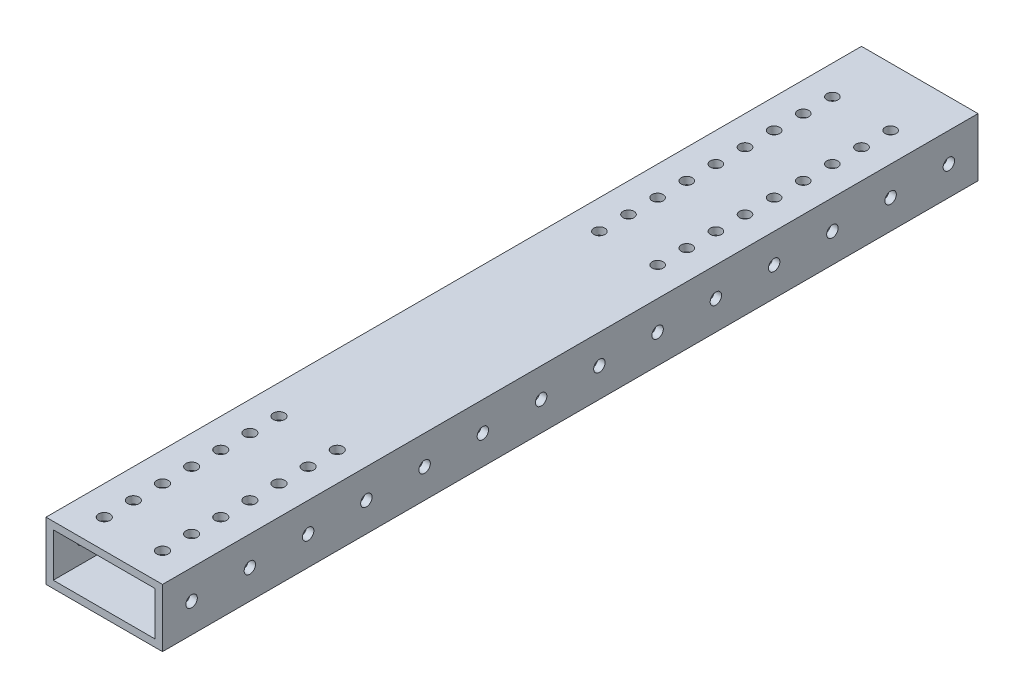
from build123d import *

# Parameters (mm, degrees)
SKETCH1_W           = 50.8
SKETCH1_H           = 25.4
SKETCH1_W_2         = 44.45
SKETCH1_H_2         = 19.05
BOSS_EXTRUDE1_DEPTH = 177.8
CUT_EXTRUDE1_REACH  = 183.392
SKETCH2_R           = 2.4892
SKETCH3_R           = 2.4892
CUT_EXTRUDE2_DEPTH  = 186.350397895
SKETCH4_R           = 2.413
CUT_EXTRUDE3_DEPTH  = 182.392282085


with BuildPart() as part:
    # Sketch1 → Boss-Extrude1 (new, symmetric)
    with BuildSketch(Plane.XY):
        Rectangle(SKETCH1_W, SKETCH1_H)
        Rectangle(SKETCH1_W_2, SKETCH1_H_2, mode=Mode.SUBTRACT)
    extrude(amount=BOSS_EXTRUDE1_DEPTH, both=True)

    # Sketch2 → Cut-Extrude1 (cut, up to next)
    with BuildSketch(Plane.XZ.offset(-12.7), mode=Mode.PRIVATE) as cut_extrude1_sk1:
        with Locations((-12.7, 165.1)):
            Circle(SKETCH2_R)
    cut_extrude1_tool1 = extrude(cut_extrude1_sk1.sketch, amount=CUT_EXTRUDE1_REACH, mode=Mode.PRIVATE) & part.part
    # Sketch2 → Cut-Extrude1 (cut, up to next)
    with BuildSketch(Plane.XZ.offset(-12.7), mode=Mode.PRIVATE) as cut_extrude1_sk2:
        with Locations((-12.7, 152.4)):
            Circle(SKETCH2_R)
    cut_extrude1_tool2 = extrude(cut_extrude1_sk2.sketch, amount=CUT_EXTRUDE1_REACH, mode=Mode.PRIVATE) & part.part
    # Sketch2 → Cut-Extrude1 (cut, up to next)
    with BuildSketch(Plane.XZ.offset(-12.7), mode=Mode.PRIVATE) as cut_extrude1_sk3:
        with Locations((-12.7, 139.7)):
            Circle(SKETCH2_R)
    cut_extrude1_tool3 = extrude(cut_extrude1_sk3.sketch, amount=CUT_EXTRUDE1_REACH, mode=Mode.PRIVATE) & part.part
    # Sketch2 → Cut-Extrude1 (cut, up to next)
    with BuildSketch(Plane.XZ.offset(-12.7), mode=Mode.PRIVATE) as cut_extrude1_sk4:
        with Locations((-12.7, 127)):
            Circle(SKETCH2_R)
    cut_extrude1_tool4 = extrude(cut_extrude1_sk4.sketch, amount=CUT_EXTRUDE1_REACH, mode=Mode.PRIVATE) & part.part
    # Sketch2 → Cut-Extrude1 (cut, up to next)
    with BuildSketch(Plane.XZ.offset(-12.7), mode=Mode.PRIVATE) as cut_extrude1_sk5:
        with Locations((-12.7, 114.3)):
            Circle(SKETCH2_R)
    cut_extrude1_tool5 = extrude(cut_extrude1_sk5.sketch, amount=CUT_EXTRUDE1_REACH, mode=Mode.PRIVATE) & part.part
    # Sketch2 → Cut-Extrude1 (cut, up to next)
    with BuildSketch(Plane.XZ.offset(-12.7), mode=Mode.PRIVATE) as cut_extrude1_sk6:
        with Locations((-12.7, 101.6)):
            Circle(SKETCH2_R)
    cut_extrude1_tool6 = extrude(cut_extrude1_sk6.sketch, amount=CUT_EXTRUDE1_REACH, mode=Mode.PRIVATE) & part.part
    # Sketch2 → Cut-Extrude1 (cut, up to next)
    with BuildSketch(Plane.XZ.offset(-12.7), mode=Mode.PRIVATE) as cut_extrude1_sk7:
        with Locations((-12.7, 88.9)):
            Circle(SKETCH2_R)
    cut_extrude1_tool7 = extrude(cut_extrude1_sk7.sketch, amount=CUT_EXTRUDE1_REACH, mode=Mode.PRIVATE) & part.part
    # Sketch2 → Cut-Extrude1 (cut, up to next)
    with BuildSketch(Plane.XZ.offset(-12.7), mode=Mode.PRIVATE) as cut_extrude1_sk8:
        with Locations((12.7, 165.1)):
            Circle(SKETCH2_R)
    cut_extrude1_tool8 = extrude(cut_extrude1_sk8.sketch, amount=CUT_EXTRUDE1_REACH, mode=Mode.PRIVATE) & part.part
    # Sketch2 → Cut-Extrude1 (cut, up to next)
    with BuildSketch(Plane.XZ.offset(-12.7), mode=Mode.PRIVATE) as cut_extrude1_sk9:
        with Locations((12.7, 152.4)):
            Circle(SKETCH2_R)
    cut_extrude1_tool9 = extrude(cut_extrude1_sk9.sketch, amount=CUT_EXTRUDE1_REACH, mode=Mode.PRIVATE) & part.part
    # Sketch2 → Cut-Extrude1 (cut, up to next)
    with BuildSketch(Plane.XZ.offset(-12.7), mode=Mode.PRIVATE) as cut_extrude1_sk10:
        with Locations((12.7, 139.7)):
            Circle(SKETCH2_R)
    cut_extrude1_tool10 = extrude(cut_extrude1_sk10.sketch, amount=CUT_EXTRUDE1_REACH, mode=Mode.PRIVATE) & part.part
    # Sketch2 → Cut-Extrude1 (cut, up to next)
    with BuildSketch(Plane.XZ.offset(-12.7), mode=Mode.PRIVATE) as cut_extrude1_sk11:
        with Locations((12.7, 127)):
            Circle(SKETCH2_R)
    cut_extrude1_tool11 = extrude(cut_extrude1_sk11.sketch, amount=CUT_EXTRUDE1_REACH, mode=Mode.PRIVATE) & part.part
    # Sketch2 → Cut-Extrude1 (cut, up to next)
    with BuildSketch(Plane.XZ.offset(-12.7), mode=Mode.PRIVATE) as cut_extrude1_sk12:
        with Locations((12.7, 114.3)):
            Circle(SKETCH2_R)
    cut_extrude1_tool12 = extrude(cut_extrude1_sk12.sketch, amount=CUT_EXTRUDE1_REACH, mode=Mode.PRIVATE) & part.part
    # Sketch2 → Cut-Extrude1 (cut, up to next)
    with BuildSketch(Plane.XZ.offset(-12.7), mode=Mode.PRIVATE) as cut_extrude1_sk13:
        with Locations((12.7, 101.6)):
            Circle(SKETCH2_R)
    cut_extrude1_tool13 = extrude(cut_extrude1_sk13.sketch, amount=CUT_EXTRUDE1_REACH, mode=Mode.PRIVATE) & part.part
    # Sketch2 → Cut-Extrude1 (cut, up to next)
    with BuildSketch(Plane.XZ.offset(-12.7), mode=Mode.PRIVATE) as cut_extrude1_sk14:
        with Locations((12.7, 88.9)):
            Circle(SKETCH2_R)
    cut_extrude1_tool14 = extrude(cut_extrude1_sk14.sketch, amount=CUT_EXTRUDE1_REACH, mode=Mode.PRIVATE) & part.part
    add(cut_extrude1_tool1.solids().sort_by_distance((-12.7, 12.7, 165.1))[0], mode=Mode.SUBTRACT)
    add(cut_extrude1_tool2.solids().sort_by_distance((-12.7, 12.7, 152.4))[0], mode=Mode.SUBTRACT)
    add(cut_extrude1_tool3.solids().sort_by_distance((-12.7, 12.7, 139.7))[0], mode=Mode.SUBTRACT)
    add(cut_extrude1_tool4.solids().sort_by_distance((-12.7, 12.7, 127))[0], mode=Mode.SUBTRACT)
    add(cut_extrude1_tool5.solids().sort_by_distance((-12.7, 12.7, 114.3))[0], mode=Mode.SUBTRACT)
    add(cut_extrude1_tool6.solids().sort_by_distance((-12.7, 12.7, 101.6))[0], mode=Mode.SUBTRACT)
    add(cut_extrude1_tool7.solids().sort_by_distance((-12.7, 12.7, 88.9))[0], mode=Mode.SUBTRACT)
    add(cut_extrude1_tool8.solids().sort_by_distance((12.7, 12.7, 165.1))[0], mode=Mode.SUBTRACT)
    add(cut_extrude1_tool9.solids().sort_by_distance((12.7, 12.7, 152.4))[0], mode=Mode.SUBTRACT)
    add(cut_extrude1_tool10.solids().sort_by_distance((12.7, 12.7, 139.7))[0], mode=Mode.SUBTRACT)
    add(cut_extrude1_tool11.solids().sort_by_distance((12.7, 12.7, 127))[0], mode=Mode.SUBTRACT)
    add(cut_extrude1_tool12.solids().sort_by_distance((12.7, 12.7, 114.3))[0], mode=Mode.SUBTRACT)
    add(cut_extrude1_tool13.solids().sort_by_distance((12.7, 12.7, 101.6))[0], mode=Mode.SUBTRACT)
    add(cut_extrude1_tool14.solids().sort_by_distance((12.7, 12.7, 88.9))[0], mode=Mode.SUBTRACT)

    # Sketch3 → Cut-Extrude2 (cut, through all)
    with BuildSketch(Plane(origin=(25.4, 0, 0), x_dir=(0, 0, -1), z_dir=(1, 0, 0))):
        with Locations((-165.1, 0)):
            Circle(SKETCH3_R)
        with Locations((-139.7, 0)):
            Circle(SKETCH3_R)
        with Locations((-114.3, 0)):
            Circle(SKETCH3_R)
        with Locations((-88.9, 0)):
            Circle(SKETCH3_R)
        with Locations((-63.5, 0)):
            Circle(SKETCH3_R)
        with Locations((-38.1, 0)):
            Circle(SKETCH3_R)
        with Locations((-12.7, 0)):
            Circle(SKETCH3_R)
        with Locations((12.7, 0)):
            Circle(SKETCH3_R)
        with Locations((38.1, 0)):
            Circle(SKETCH3_R)
        with Locations((63.5, 0)):
            Circle(SKETCH3_R)
        with Locations((88.9, 0)):
            Circle(SKETCH3_R)
        with Locations((114.3, 0)):
            Circle(SKETCH3_R)
        with Locations((139.7, 0)):
            Circle(SKETCH3_R)
        with Locations((165.1, 0)):
            Circle(SKETCH3_R)
    extrude(amount=-CUT_EXTRUDE2_DEPTH, mode=Mode.SUBTRACT)

    # Sketch4 → Cut-Extrude3 (cut, through all)
    with BuildSketch(Plane.XZ.offset(12.7)):
        with Locations((-12.7, -152.4)):
            Circle(SKETCH4_R)
        with Locations((-12.7, -139.7)):
            Circle(SKETCH4_R)
        with Locations((-12.7, -127)):
            Circle(SKETCH4_R)
        with Locations((-12.7, -114.3)):
            Circle(SKETCH4_R)
        with Locations((-12.7, -101.6)):
            Circle(SKETCH4_R)
        with Locations((-12.7, -88.9)):
            Circle(SKETCH4_R)
        with Locations((-12.7, -76.2)):
            Circle(SKETCH4_R)
        with Locations((-12.7, -63.5)):
            Circle(SKETCH4_R)
        with Locations((-12.7, -50.8)):
            Circle(SKETCH4_R)
        with Locations((12.7, -50.8)):
            Circle(SKETCH4_R)
        with Locations((12.7, -63.5)):
            Circle(SKETCH4_R)
        with Locations((12.7, -76.2)):
            Circle(SKETCH4_R)
        with Locations((12.7, -88.9)):
            Circle(SKETCH4_R)
        with Locations((12.7, -101.6)):
            Circle(SKETCH4_R)
        with Locations((12.7, -114.3)):
            Circle(SKETCH4_R)
        with Locations((12.7, -127)):
            Circle(SKETCH4_R)
        with Locations((12.7, -139.7)):
            Circle(SKETCH4_R)
        with Locations((12.7, -152.4)):
            Circle(SKETCH4_R)
    extrude(amount=-CUT_EXTRUDE3_DEPTH, mode=Mode.SUBTRACT)


solid = part.part
